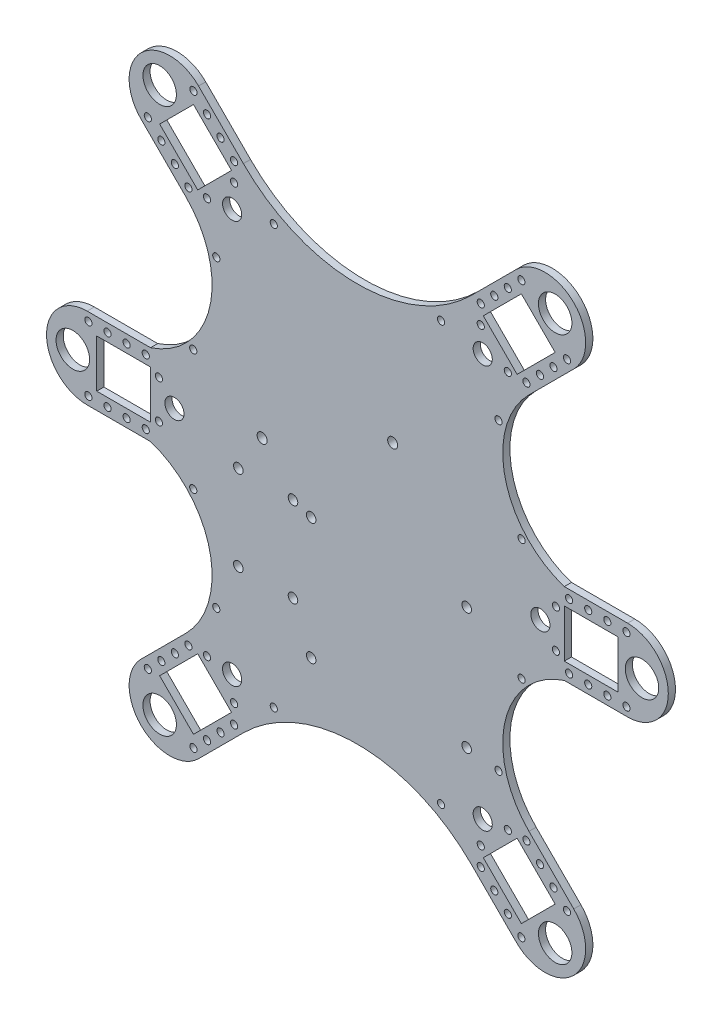
from build123d import *

# Parameters (mm, degrees)
MODEL_R                     = 1.5
MODEL_R_2                   = 6.999999998
MODEL_R_3                   = 7
MODEL_R_4                   = 2
MODEL_R_5                   = 2.1
MODEL_R_6                   = 4
MODEL_W                     = 22.4999944
MODEL_H                     = 20
DODANIE_WYCI_GNI_CIE1_DEPTH = 3
SZKIC1_R                    = 1.5
WYTNIJ_WYCI_GNI_CIE1_DEPTH  = 2610.678585479


with BuildPart() as part:
    # Model → Dodanie-wyciągnięcie1 (new body)
    with BuildSketch(Plane.XY):
        with BuildLine():
            Line((2252.094823484, 928.36601814), (2233.356493793, 947.104347831))
            ThreePointArc((2233.356493793, 947.104347831), (2209.314863231, 947.104347831), (2209.314863231, 923.062717269))
            Line((2209.314863231, 923.062717269), (2228.053192947, 904.324387554))
            ThreePointArc((2228.053192947, 904.324387554), (2238.000533389, 869.176782475), (2213.278862887, 842.285469152))
            Line((2213.278862887, 842.285469152), (2186.778862868, 842.285469152))
            ThreePointArc((2186.778862868, 842.285469152), (2169.778862868, 825.285469152), (2186.778862868, 808.285469152))
            Line((2186.778862868, 808.285469152), (2213.278862887, 808.285469152))
            ThreePointArc((2213.278862887, 808.285469152), (2238.000533389, 781.394155828), (2228.053192947, 746.246550749))
            Line((2228.053192947, 746.246550749), (2209.314863231, 727.508221034))
            ThreePointArc((2209.314863231, 727.508221034), (2209.314863231, 703.466590473), (2233.356493793, 703.466590472))
            Line((2233.356493793, 703.466590472), (2252.094823484, 722.204920163))
            ThreePointArc((2252.094823484, 722.204920163), (2299.791718302, 741.96162088), (2347.488613121, 722.204920163))
            Line((2347.488613121, 722.204920163), (2366.226942812, 703.466590472))
            ThreePointArc((2366.226942812, 703.466590472), (2390.268573374, 703.466590473), (2390.268573373, 727.508221034))
            Line((2390.268573373, 727.508221034), (2371.530243658, 746.246550749))
            ThreePointArc((2371.530243658, 746.246550749), (2361.582903216, 781.394155828), (2386.304573718, 808.285469152))
            Line((2386.304573718, 808.285469152), (2412.804573737, 808.285469152))
            ThreePointArc((2412.804573737, 808.285469152), (2429.804573737, 825.285469152), (2412.804573737, 842.285469152))
            Line((2412.804573737, 842.285469152), (2386.304573718, 842.285469152))
            ThreePointArc((2386.304573718, 842.285469152), (2361.582903216, 869.176782475), (2371.530243658, 904.324387554))
            Line((2371.530243658, 904.324387554), (2390.268573373, 923.062717269))
            ThreePointArc((2390.268573373, 923.062717269), (2390.268573374, 947.104347831), (2366.226942812, 947.104347831))
            Line((2366.226942812, 947.104347831), (2347.488613121, 928.36601814))
            ThreePointArc((2347.488613121, 928.36601814), (2299.791718302, 908.609317423), (2252.094823484, 928.36601814))
        make_face()
        with Locations((2242.548881948, 717.608726084)):
            Circle(MODEL_R, mode=Mode.SUBTRACT)
        with Locations((2248.205736198, 927.30535797)):
            Circle(MODEL_R, mode=Mode.SUBTRACT)
        with Locations((2248.205736198, 919.527183377)):
            Circle(MODEL_R, mode=Mode.SUBTRACT)
        with Locations((2229.113853106, 908.213474878)):
            Circle(MODEL_R, mode=Mode.SUBTRACT)
        with Locations((2223.456998856, 913.870329127)):
            Circle(MODEL_R, mode=Mode.SUBTRACT)
        with Locations((2217.800144607, 919.527183377)):
            Circle(MODEL_R, mode=Mode.SUBTRACT)
        with Locations((2212.143290357, 925.184037626)):
            Circle(MODEL_R, mode=Mode.SUBTRACT)
        with Locations((2217.093037826, 939.32617325)):
            Circle(MODEL_R_2, mode=Mode.SUBTRACT)
        with Locations((2236.892027699, 908.213474878)):
            Circle(MODEL_R, mode=Mode.SUBTRACT)
        with Locations((2231.235173449, 944.275920718)):
            Circle(MODEL_R, mode=Mode.SUBTRACT)
        with Locations((2236.892027699, 938.619066469)):
            Circle(MODEL_R, mode=Mode.SUBTRACT)
        with Locations((2242.548881948, 932.962212219)):
            Circle(MODEL_R, mode=Mode.SUBTRACT)
        with Locations((2236.892027699, 711.951871835)):
            Circle(MODEL_R, mode=Mode.SUBTRACT)
        with Locations((2180.778857268, 825.285469149)):
            Circle(MODEL_R_3, mode=Mode.SUBTRACT)
        with Locations((2187.278857269, 838.785469147)):
            Circle(MODEL_R, mode=Mode.SUBTRACT)
        with Locations((2195.278857269, 838.785469147)):
            Circle(MODEL_R, mode=Mode.SUBTRACT)
        with Locations((2203.278857269, 838.785469147)):
            Circle(MODEL_R, mode=Mode.SUBTRACT)
        with Locations((2187.278857269, 811.785469147)):
            Circle(MODEL_R, mode=Mode.SUBTRACT)
        with Locations((2195.278857269, 811.785469147)):
            Circle(MODEL_R, mode=Mode.SUBTRACT)
        with Locations((2203.278857269, 811.785469147)):
            Circle(MODEL_R, mode=Mode.SUBTRACT)
        with Locations((2211.278857269, 811.785469147)):
            Circle(MODEL_R, mode=Mode.SUBTRACT)
        with Locations((2216.778857269, 817.285469147)):
            Circle(MODEL_R, mode=Mode.SUBTRACT)
        with Locations((2211.278857269, 838.785469147)):
            Circle(MODEL_R, mode=Mode.SUBTRACT)
        with Locations((2216.778857269, 833.285469147)):
            Circle(MODEL_R, mode=Mode.SUBTRACT)
        with Locations((2231.235173449, 706.295017585)):
            Circle(MODEL_R, mode=Mode.SUBTRACT)
        with Locations((2236.892027699, 742.357463426)):
            Circle(MODEL_R, mode=Mode.SUBTRACT)
        with Locations((2217.093037826, 711.244765054)):
            Circle(MODEL_R_2, mode=Mode.SUBTRACT)
        with Locations((2212.143290357, 725.386900677)):
            Circle(MODEL_R, mode=Mode.SUBTRACT)
        with Locations((2217.800144607, 731.043754927)):
            Circle(MODEL_R, mode=Mode.SUBTRACT)
        with Locations((2223.456998856, 736.700609176)):
            Circle(MODEL_R, mode=Mode.SUBTRACT)
        with Locations((2229.113853106, 742.357463426)):
            Circle(MODEL_R, mode=Mode.SUBTRACT)
        with Locations((2248.205736198, 731.043754927)):
            Circle(MODEL_R, mode=Mode.SUBTRACT)
        with Locations((2248.205736198, 723.265580334)):
            Circle(MODEL_R, mode=Mode.SUBTRACT)
        with Locations((2351.377700407, 723.265580334)):
            Circle(MODEL_R, mode=Mode.SUBTRACT)
        with Locations((2351.377700407, 731.043754927)):
            Circle(MODEL_R, mode=Mode.SUBTRACT)
        with Locations((2370.469583499, 742.357463426)):
            Circle(MODEL_R, mode=Mode.SUBTRACT)
        with Locations((2376.126437748, 736.700609176)):
            Circle(MODEL_R, mode=Mode.SUBTRACT)
        with Locations((2381.783291998, 731.043754927)):
            Circle(MODEL_R, mode=Mode.SUBTRACT)
        with Locations((2387.440146247, 725.386900677)):
            Circle(MODEL_R, mode=Mode.SUBTRACT)
        with Locations((2382.490398779, 711.244765054)):
            Circle(MODEL_R_2, mode=Mode.SUBTRACT)
        with Locations((2362.691408906, 742.357463426)):
            Circle(MODEL_R, mode=Mode.SUBTRACT)
        with Locations((2368.348263155, 706.295017585)):
            Circle(MODEL_R, mode=Mode.SUBTRACT)
        with Locations((2382.804579335, 833.285469147)):
            Circle(MODEL_R, mode=Mode.SUBTRACT)
        with Locations((2388.304579335, 838.785469147)):
            Circle(MODEL_R, mode=Mode.SUBTRACT)
        with Locations((2382.804579335, 817.285469147)):
            Circle(MODEL_R, mode=Mode.SUBTRACT)
        with Locations((2388.304579335, 811.785469147)):
            Circle(MODEL_R, mode=Mode.SUBTRACT)
        with Locations((2396.304579335, 811.785469147)):
            Circle(MODEL_R, mode=Mode.SUBTRACT)
        with Locations((2404.304579335, 811.785469147)):
            Circle(MODEL_R, mode=Mode.SUBTRACT)
        with Locations((2412.304579335, 811.785469147)):
            Circle(MODEL_R, mode=Mode.SUBTRACT)
        with Locations((2396.304579335, 838.785469147)):
            Circle(MODEL_R, mode=Mode.SUBTRACT)
        with Locations((2404.304579335, 838.785469147)):
            Circle(MODEL_R, mode=Mode.SUBTRACT)
        with Locations((2412.304579335, 838.785469147)):
            Circle(MODEL_R, mode=Mode.SUBTRACT)
        with Locations((2418.804579336, 825.285469149)):
            Circle(MODEL_R_3, mode=Mode.SUBTRACT)
        with Locations((2362.691408906, 711.951871835)):
            Circle(MODEL_R, mode=Mode.SUBTRACT)
        with Locations((2357.034554656, 932.962212219)):
            Circle(MODEL_R, mode=Mode.SUBTRACT)
        with Locations((2362.691408906, 938.619066469)):
            Circle(MODEL_R, mode=Mode.SUBTRACT)
        with Locations((2368.348263155, 944.275920718)):
            Circle(MODEL_R, mode=Mode.SUBTRACT)
        with Locations((2362.691408906, 908.213474878)):
            Circle(MODEL_R, mode=Mode.SUBTRACT)
        with Locations((2382.490398779, 939.32617325)):
            Circle(MODEL_R_2, mode=Mode.SUBTRACT)
        with Locations((2387.440146247, 925.184037626)):
            Circle(MODEL_R, mode=Mode.SUBTRACT)
        with Locations((2381.783291998, 919.527183377)):
            Circle(MODEL_R, mode=Mode.SUBTRACT)
        with Locations((2376.126437748, 913.870329127)):
            Circle(MODEL_R, mode=Mode.SUBTRACT)
        with Locations((2370.469583499, 908.213474878)):
            Circle(MODEL_R, mode=Mode.SUBTRACT)
        with Locations((2351.377700407, 919.527183377)):
            Circle(MODEL_R, mode=Mode.SUBTRACT)
        with Locations((2351.377700407, 927.30535797)):
            Circle(MODEL_R, mode=Mode.SUBTRACT)
        with Locations((2357.034554656, 717.608726084)):
            Circle(MODEL_R, mode=Mode.SUBTRACT)
        with Locations((2345.479718302, 814.428025354)):
            Circle(MODEL_R_4, mode=Mode.SUBTRACT)
        with Locations((2345.479718302, 763.588025354)):
            Circle(MODEL_R_4, mode=Mode.SUBTRACT)
        with Locations((2280.455718302, 763.588025354)):
            Circle(MODEL_R_4, mode=Mode.SUBTRACT)
        with Locations((2280.455718302, 814.428025354)):
            Circle(MODEL_R_4, mode=Mode.SUBTRACT)
        with Locations((2259.943718302, 832.908025354)):
            Circle(MODEL_R_5, mode=Mode.SUBTRACT)
        with Locations((2314.543718302, 858.508025354)):
            Circle(MODEL_R_5, mode=Mode.SUBTRACT)
        with Locations((2247.391320383, 909.520379406)):
            Circle(MODEL_R_6, mode=Mode.SUBTRACT)
        with Locations((2247.391320383, 741.050558897)):
            Circle(MODEL_R_6, mode=Mode.SUBTRACT)
        with Locations((2223.278857269, 825.285469152)):
            Circle(MODEL_R_6, mode=Mode.SUBTRACT)
        with Locations((2352.192116222, 741.050558897)):
            Circle(MODEL_R_6, mode=Mode.SUBTRACT)
        with Locations((2376.304579335, 825.285469152)):
            Circle(MODEL_R_6, mode=Mode.SUBTRACT)
        with Locations((2352.192116222, 909.520379406)):
            Circle(MODEL_R_6, mode=Mode.SUBTRACT)
        with Locations((2272.851718302, 781.408025354)):
            Circle(MODEL_R_4, mode=Mode.SUBTRACT)
        with Locations((2249.991718302, 781.408025354)):
            Circle(MODEL_R_4, mode=Mode.SUBTRACT)
        with Locations((2272.851718302, 816.968025354)):
            Circle(MODEL_R_4, mode=Mode.SUBTRACT)
        with Locations((2249.991718302, 816.968025354)):
            Circle(MODEL_R_4, mode=Mode.SUBTRACT)
        Polygon((2247.145076026, 923.416270673), (2231.235173453, 939.326173247), (2217.093037828, 925.184037622), (2233.002940402, 909.274135049), align=None, mode=Mode.SUBTRACT)
        with Locations((2202.028860069, 825.285469147)):
            Rectangle(MODEL_W, MODEL_H, mode=Mode.SUBTRACT)
        Polygon((2231.235173453, 711.244765057), (2217.093037828, 725.386900681), (2233.002940402, 741.296803255), (2247.145076026, 727.15466763), align=None, mode=Mode.SUBTRACT)
        Polygon((2352.438360578, 727.15466763), (2368.348263152, 711.244765057), (2382.490398776, 725.386900681), (2366.580496203, 741.296803255), align=None, mode=Mode.SUBTRACT)
        with Locations((2397.554576535, 825.285469147)):
            Rectangle(MODEL_W, MODEL_H, mode=Mode.SUBTRACT)
        Polygon((2368.348263152, 939.326173247), (2382.490398776, 925.184037622), (2366.580496203, 909.274135049), (2352.438360578, 923.416270673), align=None, mode=Mode.SUBTRACT)
    extrude(amount=DODANIE_WYCI_GNI_CIE1_DEPTH)

    # Szkic1 → Wytnij-wyciągnięcie1 (cut, through all)
    with BuildSketch(Plane.XY.offset(3)):
        with Locations((2334.760691049, 737.761269348)):
            Circle(SZKIC1_R)
        with Locations((2358.80232161, 761.802899909)):
            Circle(SZKIC1_R)
        with Locations((2368.442851257, 800.011410924)):
            Circle(SZKIC1_R)
        with Locations((2368.442851257, 850.55952738)):
            Circle(SZKIC1_R)
        with Locations((2358.80232161, 888.768038394)):
            Circle(SZKIC1_R)
        with Locations((2334.760691049, 912.809668955)):
            Circle(SZKIC1_R)
        with Locations((2264.822745556, 912.809668955)):
            Circle(SZKIC1_R)
        with Locations((2240.781114995, 888.768038394)):
            Circle(SZKIC1_R)
        with Locations((2231.140585347, 850.55952738)):
            Circle(SZKIC1_R)
        with Locations((2231.140585347, 800.011410924)):
            Circle(SZKIC1_R)
        with Locations((2240.781114995, 761.802899909)):
            Circle(SZKIC1_R)
        with Locations((2264.822745556, 737.761269348)):
            Circle(SZKIC1_R)
    extrude(amount=-WYTNIJ_WYCI_GNI_CIE1_DEPTH, mode=Mode.SUBTRACT)


solid = part.part
